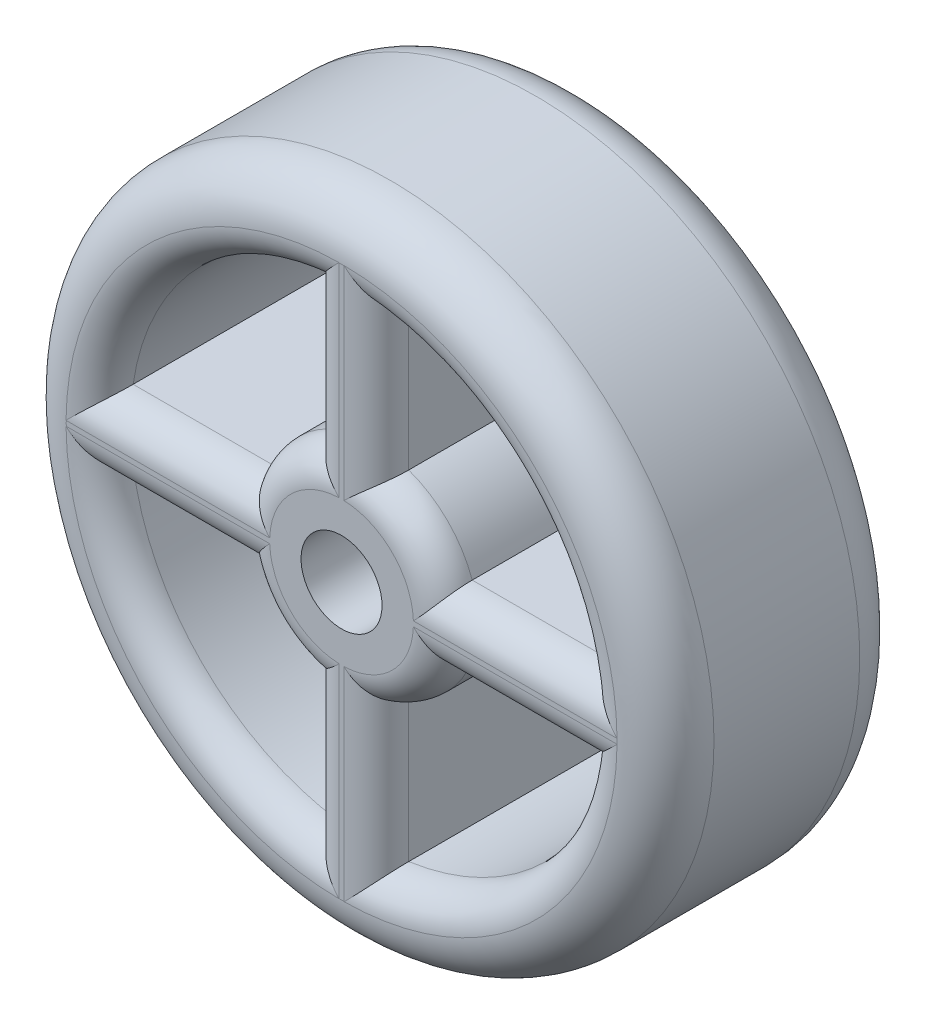
from build123d import *

# Parameters (mm, degrees)
SKETCH2_R           = 20
SKETCH2_R_2         = 2.5
BOSS_EXTRUDE1_DEPTH = 15
SKETCH3_R           = 2.41667892
BOSS_EXTRUDE2_DEPTH = 15
FILLET2_R           = 2
FILLET3_R           = 3
SKETCH4_R           = 2.46809762
CUT_EXTRUDE1_DEPTH  = 7.5
CUT_EXTRUDE2_START  = -10
SKETCH5_R           = 2.5
CUT_EXTRUDE2_DEPTH  = 10


with BuildPart() as part:
    # Sketch2 → Boss-Extrude1 (new body)
    with BuildSketch(Plane.XY):
        Circle(SKETCH2_R)
        Circle(SKETCH2_R_2, mode=Mode.SUBTRACT)
        with BuildLine():
            Line((-2.146310324, 6.070682338), (-2.146310324, 14.870074118))
            ThreePointArc((-2.146310324, 14.870074118), (-10.623694091, 10.623694091), (-14.870074118, 2.146310324))
            Line((-14.870074118, 2.146310324), (-6.070682338, 2.146310324))
            ThreePointArc((-6.070682338, 2.146310324), (-4.553011753, 4.553011753), (-2.146310324, 6.070682338))
        make_face(mode=Mode.SUBTRACT)
        with BuildLine():
            Line((2.146310324, 6.070682338), (2.146310324, 14.870074118))
            ThreePointArc((2.146310324, 14.870074118), (10.623694091, 10.623694091), (14.870074118, 2.146310324))
            Line((14.870074118, 2.146310324), (6.070682338, 2.146310324))
            ThreePointArc((6.070682338, 2.146310324), (4.553011753, 4.553011753), (2.146310324, 6.070682338))
        make_face(mode=Mode.SUBTRACT)
        with BuildLine():
            Line((6.064732431, -2.163065556), (14.867646071, -2.163065556))
            ThreePointArc((14.867646071, -2.163065556), (10.617706659, -10.629678151), (2.146310324, -14.870074118))
            Line((2.146310324, -14.870074118), (2.146310324, -6.070682338))
            ThreePointArc((2.146310324, -6.070682338), (4.546721127, -4.5592937), (6.064732431, -2.163065556))
        make_face(mode=Mode.SUBTRACT)
        with BuildLine():
            Line((-2.146310324, -6.070682338), (-2.146310324, -14.870074118))
            ThreePointArc((-2.146310324, -14.870074118), (-10.617706659, -10.629678151), (-14.867646071, -2.163065556))
            Line((-14.867646071, -2.163065556), (-6.064732431, -2.163065556))
            ThreePointArc((-6.064732431, -2.163065556), (-4.546721127, -4.5592937), (-2.146310324, -6.070682338))
        make_face(mode=Mode.SUBTRACT)
    extrude(amount=BOSS_EXTRUDE1_DEPTH)

    # Fillet2
    fillet2_edges = [part.edges().sort_by_distance(p)[0] for p in [
        (10.470378228, 2.146310324, 15),
        (-10.470378228, 2.146310324, 15),
        (-10.623694091, 10.623694091, 15),
        (-2.146310324, 10.470378228, 15),
        (4.553011753, 4.553011753, 15),
        (2.146310324, 10.470378228, 15),
        (10.623694091, 10.623694091, 15),
        (2.146310324, -10.470378228, 15),
        (4.546721127, -4.5592937, 15),
        (10.466189251, -2.163065556, 15),
        (10.617706659, -10.629678151, 15),
        (-10.466189251, -2.163065556, 15),
        (-4.546721127, -4.5592937, 15),
        (-2.146310324, -10.470378228, 15),
        (-10.617706659, -10.629678151, 15),
        (-4.553011753, 4.553011753, 15),
    ]]
    fillet(fillet2_edges, radius=FILLET2_R)

    # Fillet3
    # the kernel refuses this fillet: 3 mm, written as the material it takes off along each edge
    with BuildSketch(Plane(origin=(0, 0, 15), x_dir=(1, 0, 0), z_dir=(0, -1, 0))) as fillet3_piece_1:
        with BuildLine():
            CenterArc((20 - FILLET3_R, -FILLET3_R), FILLET3_R, 0, 90)
            Line((20, -FILLET3_R), (20 + FILLET3_R * 0.02, -FILLET3_R))
            Line((20 + FILLET3_R * 0.02, -FILLET3_R), (20 + FILLET3_R * 0.02, FILLET3_R * 0.02))
            Line((20 + FILLET3_R * 0.02, FILLET3_R * 0.02), (20 - FILLET3_R, FILLET3_R * 0.02))
            Line((20 - FILLET3_R, FILLET3_R * 0.02), (20 - FILLET3_R, 0))
        make_face()
    revolve(axis=Axis((0, 0, 15), (0, 0, 1)), mode=Mode.SUBTRACT)
    with BuildSketch(Plane(origin=(0, 0, 0), x_dir=(1, 0, 0), z_dir=(0, -1, 0))) as fillet3_piece_2:
        with BuildLine():
            CenterArc((20 - FILLET3_R, FILLET3_R), FILLET3_R, 270, 90)
            Line((20, FILLET3_R), (20 + FILLET3_R * 0.02, FILLET3_R))
            Line((20 + FILLET3_R * 0.02, FILLET3_R), (20 + FILLET3_R * 0.02, -FILLET3_R * 0.02))
            Line((20 + FILLET3_R * 0.02, -FILLET3_R * 0.02), (20 - FILLET3_R, -FILLET3_R * 0.02))
            Line((20 - FILLET3_R, -FILLET3_R * 0.02), (20 - FILLET3_R, 0))
        make_face()
    revolve(axis=Axis((0, 0, 0), (0, 0, 1)), mode=Mode.SUBTRACT)


with BuildPart() as body_2:
    # Sketch3 → Boss-Extrude2 (new body)
    with BuildSketch(Plane.XY.offset(15)):
        Circle(SKETCH3_R)
    extrude(amount=-BOSS_EXTRUDE2_DEPTH)

    # Sketch4 → Cut-Extrude1 (cut)
    with BuildSketch(Plane.XY.offset(15)):
        Circle(SKETCH4_R)
    extrude(amount=-CUT_EXTRUDE1_DEPTH, mode=Mode.SUBTRACT)

    # Sketch5 → Cut-Extrude2 (cut)
    with BuildSketch(Plane.XY.offset(7.5).offset(CUT_EXTRUDE2_START)):
        Circle(SKETCH5_R)
    extrude(amount=CUT_EXTRUDE2_DEPTH, mode=Mode.SUBTRACT)


solid = part.part
